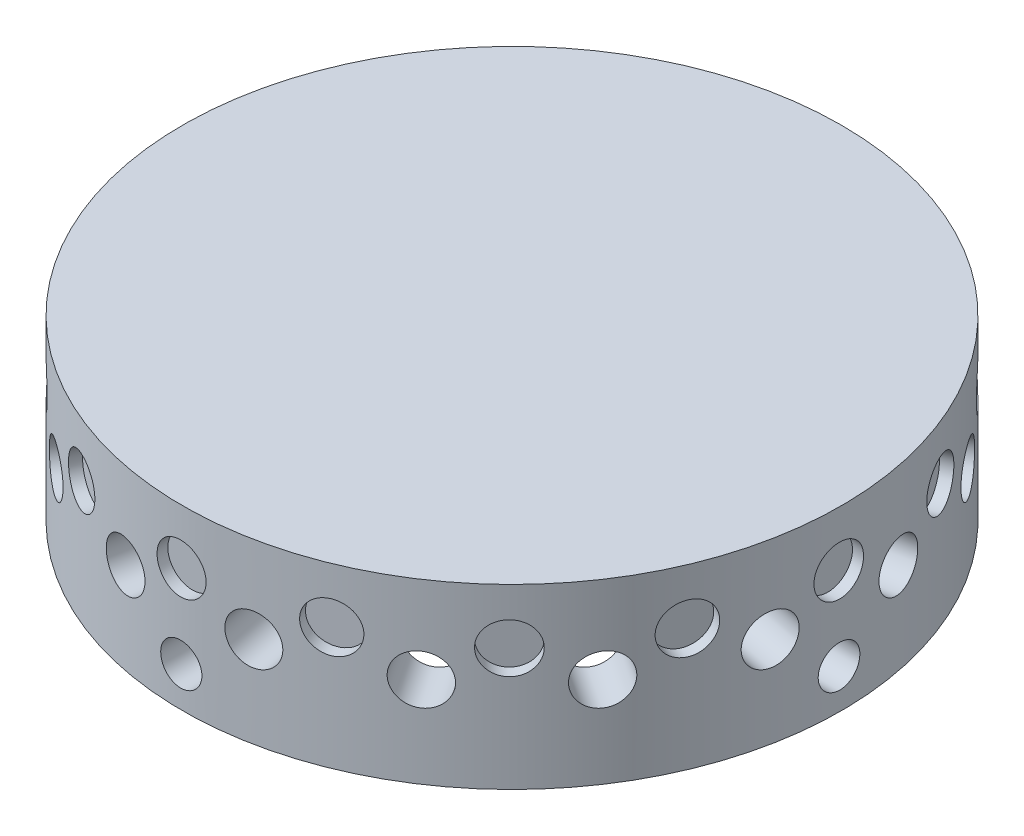
from build123d import *

# Parameters (mm, degrees)
SZKIC2_R                   = 6.25
WYTNIJ_WYCI_GNI_CIE2_DEPTH = 3
SZKIC4_R                   = 5.25
WYTNIJ_WYCI_GNI_CIE4_DEPTH = 30
SZYK_KO_OWY2_COUNT         = 4
WYTNIJ_WYCI_GNI_CIE5_REACH = 207.75
SZKIC8_R                   = 6.25
SZYK_KO_OWY3_COUNT         = 16
SZYK_KO_OWY4_COUNT         = 16


with BuildPart() as part:
    # Szkic1 → Obrót1 (revolve)
    with BuildSketch(Plane.XY):
        Polygon((0, 70.848451872), (-83.5, 70.848451872), (-83.5, 40.848451872), (-83.5, 25.848451872), (-70.5, 25.848451872), (-70.5, 65.848451872), (0, 65.848451872), align=None)
    revolve(axis=Axis((0, -200.62943078, 0), (0, 1, 0)))

    # Szkic2 → Wytnij-wyciągnięcie2 (cut)
    with BuildSketch(Plane(origin=(83.5, 0, 0), x_dir=(0, 0, -1), z_dir=(1, 0, 0))):
        with Locations((-0.467069002, 56.848451872)):
            Circle(SZKIC2_R)
    wytnij_wyci_gni_cie2 = extrude(amount=-WYTNIJ_WYCI_GNI_CIE2_DEPTH, mode=Mode.SUBTRACT)

    # Szkic4 → Wytnij-wyciągnięcie4 (cut)
    with BuildSketch(Plane(origin=(83.5, 0, 0), x_dir=(0, 0, -1), z_dir=(1, 0, 0))):
        with Locations((-0.467069002, 35.848451872)):
            Circle(SZKIC4_R)
    wytnij_wyci_gni_cie4 = extrude(amount=-WYTNIJ_WYCI_GNI_CIE4_DEPTH, mode=Mode.SUBTRACT)

    # Szyk kołowy2: Wytnij-wyciągnięcie4 ×4 about axis
    szyk_ko_owy2_axis = Axis((0, -200.62943078, 0), (0, -1, 0))
    for i in range(1, SZYK_KO_OWY2_COUNT):
        add(wytnij_wyci_gni_cie4.rotate(szyk_ko_owy2_axis, i * 360 / SZYK_KO_OWY2_COUNT), mode=Mode.SUBTRACT)

    # Szkic8 → Wytnij-wyciągnięcie5 (cut, up to next)
    with BuildSketch(Plane(origin=(81.895570914, 0, 16.290041888), x_dir=(0, -1, 0), z_dir=(0.9807852804032304, 0, 0.19509032201612872)), mode=Mode.PRIVATE) as wytnij_wyci_gni_cie5_sk1:
        with Locations((-48.848451872, 0)):
            Circle(SZKIC8_R)
    wytnij_wyci_gni_cie5_tool1 = extrude(wytnij_wyci_gni_cie5_sk1.sketch, amount=-WYTNIJ_WYCI_GNI_CIE5_REACH, mode=Mode.PRIVATE) & part.part
    wytnij_wyci_gni_cie5 = wytnij_wyci_gni_cie5_tool1.solids().sort_by_distance((81.895571, 48.848452, 16.290042))[0]
    add(wytnij_wyci_gni_cie5, mode=Mode.SUBTRACT)

    # Szyk kołowy3: Wytnij-wyciągnięcie2 ×16 about axis
    szyk_ko_owy3_axis = Axis((0, -200.62943078, 0), (0, -1, 0))
    for i in range(1, SZYK_KO_OWY3_COUNT):
        add(wytnij_wyci_gni_cie2.rotate(szyk_ko_owy3_axis, i * 360 / SZYK_KO_OWY3_COUNT), mode=Mode.SUBTRACT)

    # Szyk kołowy4: Wytnij-wyciągnięcie5 ×16 about axis
    szyk_ko_owy4_axis = Axis((0, -200.62943078, 0), (0, -1, 0))
    for i in range(1, SZYK_KO_OWY4_COUNT):
        add(wytnij_wyci_gni_cie5.rotate(szyk_ko_owy4_axis, i * 360 / SZYK_KO_OWY4_COUNT), mode=Mode.SUBTRACT)


solid = part.part
